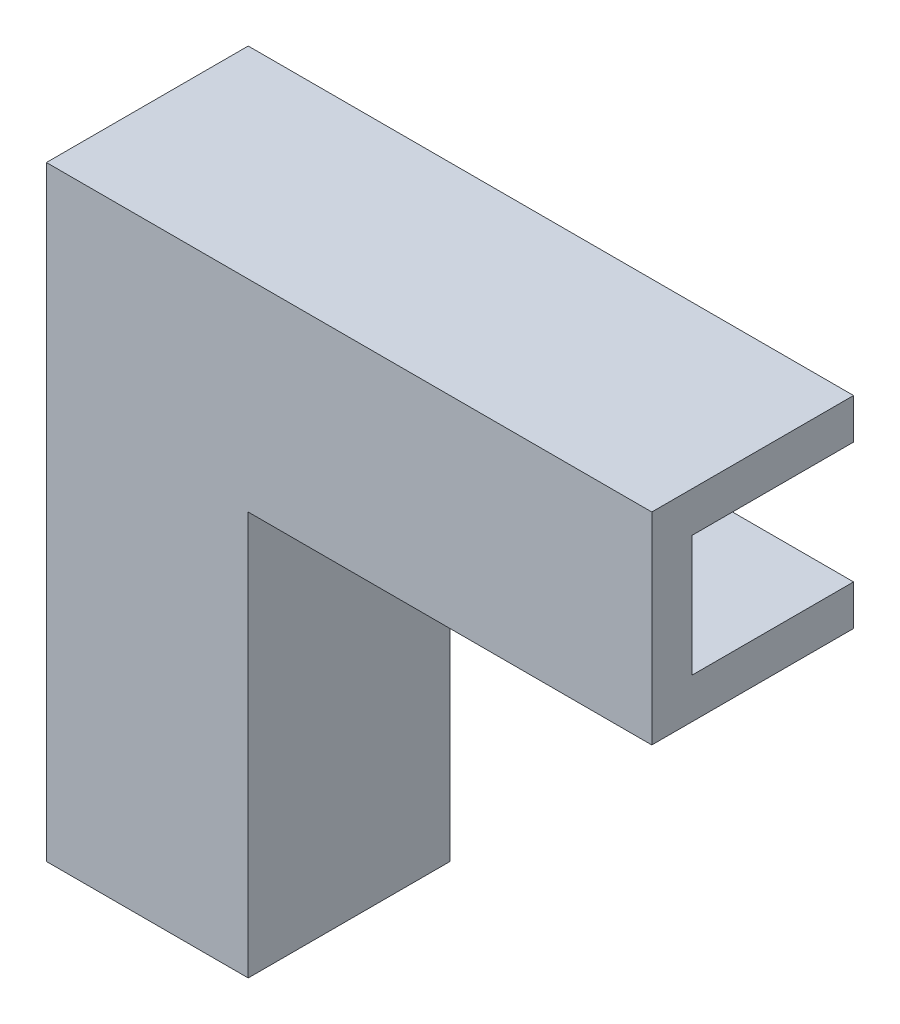
from build123d import *

# Parameters (mm, degrees)
BOSS_EXTRU_1_DEPTH      = 5
ESQUISSE2_W             = 3
ESQUISSE2_H             = 4
ENL_V_MAT_EXTRU_1_DEPTH = 14
ESQUISSE3_W             = 4
ESQUISSE3_H             = 3
ENL_V_MAT_EXTRU_2_DEPTH = 14


with BuildPart() as part:
    # Esquisse1 → Boss.-Extru.1 (new body)
    with BuildSketch(Plane.XY):
        Polygon((-1.317889251, -12.63356974), (-1.317889251, -2.63356974), (8.682110749, -2.63356974), (8.682110749, 2.36643026), (-6.317889251, 2.36643026), (-6.317889251, -12.63356974), align=None)
    extrude(amount=BOSS_EXTRU_1_DEPTH)

    # Esquisse2 → Enlèv. mat.-Extru.1 (cut)
    with BuildSketch(Plane.XZ.offset(12.63356974)):
        with Locations((-3.817889251, 2)):
            Rectangle(ESQUISSE2_W, ESQUISSE2_H)
    extrude(amount=-ENL_V_MAT_EXTRU_1_DEPTH, mode=Mode.SUBTRACT)

    # Esquisse3 → Enlèv. mat.-Extru.2 (cut)
    with BuildSketch(Plane(origin=(8.682110749, 0, 0), x_dir=(0, 0, -1), z_dir=(1, 0, 0))):
        with Locations((-2, -0.13356974)):
            Rectangle(ESQUISSE3_W, ESQUISSE3_H)
    extrude(amount=-ENL_V_MAT_EXTRU_2_DEPTH, mode=Mode.SUBTRACT)


solid = part.part
